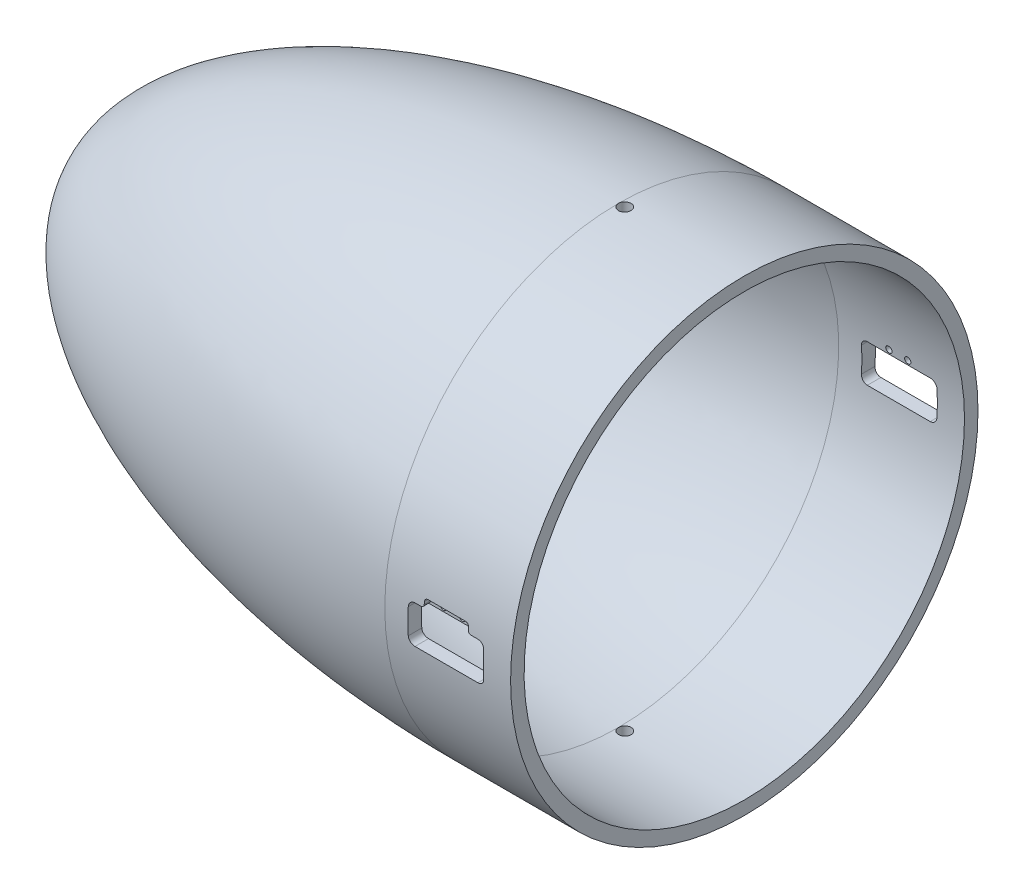
from build123d import *

# Parameters (mm, degrees)
SKETCH2_R               = 37.160284619
SKETCH2_R_2             = 35.013817528
BOSS_EXTRUDE1_DEPTH     = 20
CUT_EXTRUDE2_DEPTH      = 99.353400976
CUT_EXTRUDE2_DEPTH_BACK = 99.353400976
SKETCH3_R               = 1
CUT_EXTRUDE3_DEPTH      = 99.353400976
CUT_EXTRUDE3_DEPTH_BACK = 99.353400976
CUT_EXTRUDE4_DEPTH      = 99.353400976
CUT_EXTRUDE4_DEPTH_BACK = 99.353400976
SKETCH6_R               = 0.5
CUT_EXTRUDE5_START      = 70
SKETCH7_W               = 7
SKETCH7_H               = 1.35
CUT_EXTRUDE5_DEPTH      = 34
FILLET1_R               = 0.5
FILLET2_R               = 0.5
FILLET3_R               = 0.5
FILLET4_R               = 0.5


with BuildPart() as part:
    # Sketch1 → Revolve3 (revolve)
    with BuildSketch(Plane.XY):
        with BuildLine():
            Line((0, 37.160284619), (0, 35.013817528))
            add(Edge.make_bspline(
                [(0, 35.013817528), (-67.719103075, 30.069324796), (-65.523599131, 0)],
                knots=[4.71238898, 4.71238898, 4.71238898, 6.283185307, 6.283185307, 6.283185307], degree=2, weights=[1, 0.707106781, 1]))
            Line((-65.523599131, 0), (-83.136141035, 0))
            add(Edge.make_bspline(
                [(0, 37.160284619), (-83.136141035, 37.160284619), (-83.136141035, 0)],
                knots=[4.71238898, 4.71238898, 4.71238898, 6.283185307, 6.283185307, 6.283185307], degree=2, weights=[1, 0.707106781, 1]))
        make_face()
    revolve(axis=Axis((-83.136141035, 0, 0), (1, 0, 0)))

    # Sketch2 → Boss-Extrude1 (add)
    with BuildSketch(Plane(origin=(0, 0, 0), x_dir=(0, 0, -1), z_dir=(1, 0, 0))):
        Circle(SKETCH2_R)
        Circle(SKETCH2_R_2, mode=Mode.SUBTRACT)
    extrude(amount=BOSS_EXTRUDE1_DEPTH)

    # Sketch3 → Cut-Extrude2 (cut, two sides: drawn at the far end of the back side and taken through both)
    with BuildSketch(Plane(origin=(0, 0, 0), x_dir=(1, 0, 0), z_dir=(0, 1, 0)).offset(-CUT_EXTRUDE2_DEPTH_BACK)):
        with Locations((1, 0)):
            Circle(SKETCH3_R)
    extrude(amount=CUT_EXTRUDE2_DEPTH + CUT_EXTRUDE2_DEPTH_BACK, mode=Mode.SUBTRACT)

    # Sketch5 → Cut-Extrude3 (cut, two sides: drawn at the far end of the back side and taken through both)
    with BuildSketch(Plane.XY.offset(-CUT_EXTRUDE3_DEPTH_BACK)):
        with BuildLine():
            Line((4.675987147, 3), (14.675987147, 3))
            ThreePointArc((14.675987147, 3), (15.383093928, 2.707106781), (15.675987147, 2))
            Line((15.675987147, 2), (15.675987147, -2))
            ThreePointArc((15.675987147, -2), (15.383093928, -2.707106781), (14.675987147, -3))
            Line((14.675987147, -3), (4.675987147, -3))
            ThreePointArc((4.675987147, -3), (3.968880366, -2.707106781), (3.675987147, -2))
            Line((3.675987147, -2), (3.675987147, 2))
            ThreePointArc((3.675987147, 2), (3.968880366, 2.707106781), (4.675987147, 3))
        make_face()
    extrude(amount=CUT_EXTRUDE3_DEPTH + CUT_EXTRUDE3_DEPTH_BACK, mode=Mode.SUBTRACT)

    # Sketch6 → Cut-Extrude4 (cut, two sides: drawn at the far end of the back side and taken through both)
    with BuildSketch(Plane.XY.offset(-CUT_EXTRUDE4_DEPTH_BACK)):
        with Locations((11.175987147, 3.7)):
            Circle(SKETCH6_R)
        with Locations((8.175987147, 3.7)):
            Circle(SKETCH6_R)
    extrude(amount=CUT_EXTRUDE4_DEPTH + CUT_EXTRUDE4_DEPTH_BACK, mode=Mode.SUBTRACT)

    # Sketch7 → Cut-Extrude5 (cut)
    with BuildSketch(Plane.XY.offset(CUT_EXTRUDE5_START)):
        with Locations((9.606087925, 3.675)):
            Rectangle(SKETCH7_W, SKETCH7_H)
    extrude(amount=-CUT_EXTRUDE5_DEPTH, mode=Mode.SUBTRACT)

    # Fillet1
    fillet1_edges = [part.edges().sort_by_distance(p)[0] for p in [
        (6.106087925, 3, 36.519494816),
    ]]
    fillet(fillet1_edges, radius=FILLET1_R)

    # Fillet2
    fillet2_edges = [part.edges().sort_by_distance(p)[0] for p in [
        (6.106087925, 4.35, 36.452399932),
    ]]
    fillet(fillet2_edges, radius=FILLET2_R)

    # Fillet3
    fillet3_edges = [part.edges().sort_by_distance(p)[0] for p in [
        (13.106087925, 4.35, 36.452399932),
    ]]
    fillet(fillet3_edges, radius=FILLET3_R)

    # Fillet4
    fillet4_edges = [part.edges().sort_by_distance(p)[0] for p in [
        (13.106087925, 3, 36.519494816),
    ]]
    fillet(fillet4_edges, radius=FILLET4_R)


solid = part.part
